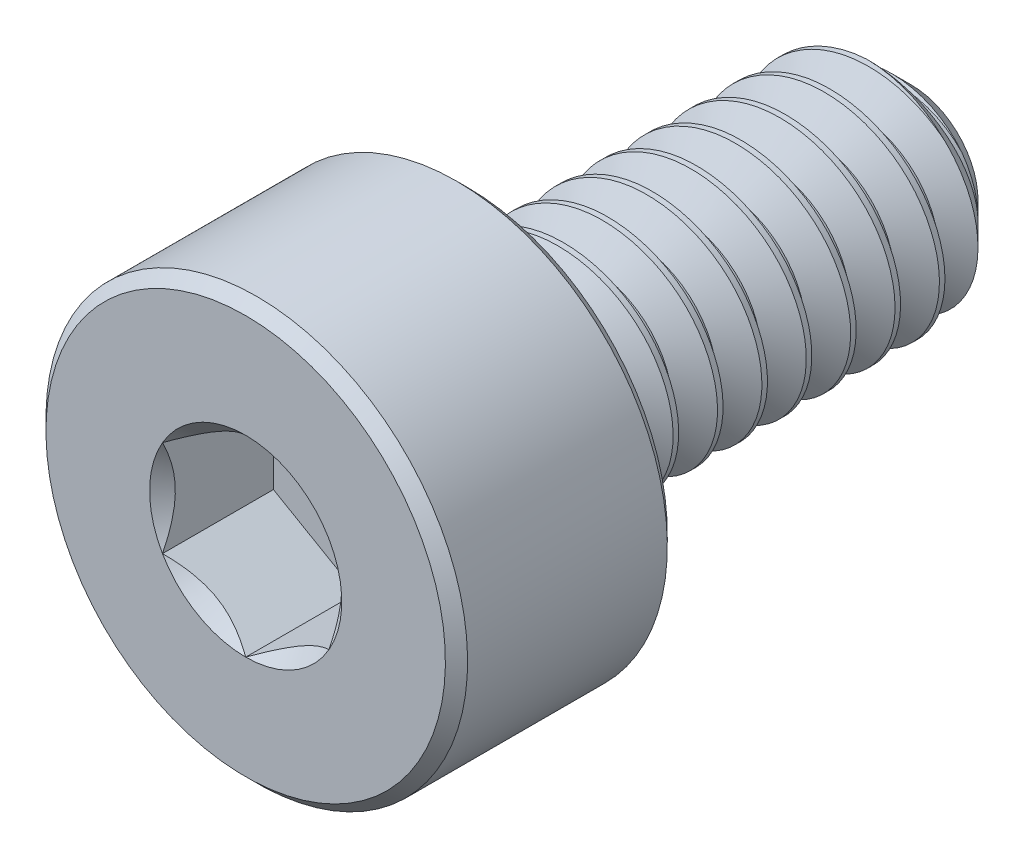
from build123d import *

# Parameters (mm, degrees)
CUT_EXTRUDE1_DEPTH = 1
CUT_SWEEP1_PITCH   = 0.4


# Read off the part's stored shape, not the designer's step: Split1
with BuildPart() as part:
    # Sketch2 → Revolve1 (revolve)
    with BuildSketch(Plane(origin=(0, 0, 0), x_dir=(0, 0, -1), z_dir=(1, 0, 0))):
        Polygon((-3, 0), (-3, 1.8), (-2.9, 1.9), (-1.1, 1.9), (-1, 1.8), (-1, 1), (2.6, 1), (3, 0.6), (3, 0), align=None)
    revolve(axis=Axis((0, 0, -3), (0, 0, 1)))

    # Sketch3 → Cut-Extrude1 (cut)
    with BuildSketch(Plane.XY.offset(3)):
        Polygon((0.75, -0.433012702), (0.75, 0.433012702), (0, 0.866025404), (-0.75, 0.433012702), (-0.75, -0.433012702), (0, -0.866025404), align=None)
    extrude(amount=-CUT_EXTRUDE1_DEPTH, mode=Mode.SUBTRACT)

    # Cut-Extrude2 cone 1 section (through the dimple's axis) → Cut-Extrude2 (revolve, cut)
    with BuildSketch(Plane(origin=(0, 0, 3), x_dir=(0, -1, 0), z_dir=(1, 0, 0))):
        Polygon((0, 0), (0.866025404, 0), (0, 0.866025404), align=None)
    revolve(axis=Axis((0, 0, 3), (0, 0, -1)), mode=Mode.SUBTRACT)


with BuildPart() as body_2:
    # Split1: the piece on the far side of the plane
    add(part.part)
    split(bisect_by=Plane.XY.offset(1), keep=Keep.BOTTOM)

    # Cut-Sweep1: the profile of Sketch7 screwed along a right-hand helix of 11.15 turns, 6 arcs to a turn; built about Z, then put on its axis
    cut_sweep1_z = Axis((0, 0, 0), (0, 0, 1))
    cut_sweep1_corners = [(1.021650635, 0, 0.0125), (1.021650635, 0, -0.3625), (0.740192379, 0, -0.2), (0.740192379, 0, -0.15)]
    with BuildLine(mode=Mode.PRIVATE) as cut_sweep1_profile:
        Line(cut_sweep1_corners[0], cut_sweep1_corners[1])
        Line(cut_sweep1_corners[1], cut_sweep1_corners[2])
        Line(cut_sweep1_corners[2], cut_sweep1_corners[3])
        Line(cut_sweep1_corners[3], cut_sweep1_corners[0])
    cut_sweep1_cap = Face(cut_sweep1_profile.wire())
    cut_sweep1_turn_angles = [0, 30, 60, 90, 120, 150, 180, 210, 240, 270, 300, 330, 360]
    cut_sweep1_turn_weights = [1, 0.8660254037844387, 1, 0.8660254037844387, 1, 0.8660254037844387, 1, 0.8660254037844387, 1, 0.8660254037844387, 1, 0.8660254037844387, 1]
    cut_sweep1_turn_rails = [Edge.make_bspline([Vector(p[0], p[1], 0).rotate(cut_sweep1_z, cut_sweep1_turn_angles[k]) / cut_sweep1_turn_weights[k] + Vector(0, 0, p[2] + CUT_SWEEP1_PITCH * cut_sweep1_turn_angles[k] / 360) for k in range(13)], [0, 0, 0, 1, 1, 2, 2, 3, 3, 4, 4, 5, 5, 6, 6, 6], 2, cut_sweep1_turn_weights) for p in cut_sweep1_corners]
    cut_sweep1_turn_sides = [Face.make_surface_from_curves(cut_sweep1_turn_rails[p[0]], cut_sweep1_turn_rails[p[1]]) for p in [(0, 1), (1, 2), (2, 3), (3, 0)]]
    cut_sweep1_last_angles = [3960, 3987, 4014]
    cut_sweep1_last_weights = [1, 0.8910065241884183, 1]
    cut_sweep1_last_rails = [Edge.make_bspline([Vector(p[0], p[1], 0).rotate(cut_sweep1_z, cut_sweep1_last_angles[k]) / cut_sweep1_last_weights[k] + Vector(0, 0, p[2] + CUT_SWEEP1_PITCH * cut_sweep1_last_angles[k] / 360) for k in range(3)], [0, 0, 0, 1, 1, 1], 2, cut_sweep1_last_weights) for p in cut_sweep1_corners]
    cut_sweep1_last_sides = [Face.make_surface_from_curves(cut_sweep1_last_rails[p[0]], cut_sweep1_last_rails[p[1]]) for p in [(0, 1), (1, 2), (2, 3), (3, 0)]]
    cut_sweep1 = Plane(origin=(0, 0, -3), x_dir=(0, 1, 0), z_dir=(0, 0, 1)) * Solid(Shell([*[p.moved(Location((0, 0, CUT_SWEEP1_PITCH * i))) for i in range(11) for p in cut_sweep1_turn_sides], *cut_sweep1_last_sides, cut_sweep1_cap, cut_sweep1_cap.rotate(cut_sweep1_z, 4014).moved(Location((0, 0, CUT_SWEEP1_PITCH * 4014 / 360)))]))
    add(cut_sweep1, mode=Mode.SUBTRACT)


with BuildPart() as part_1:
    add(part.part)

    # Split1
    split(bisect_by=Plane.XY.offset(1), keep=Keep.TOP)

    add(body_2.part)  # Boss-Extrude1 merges body 2
    # Boss-Extrude1 cone 1 section (through the dimple's axis) → Boss-Extrude1 (revolve)
    with BuildSketch(Plane(origin=(0, 0, 1), x_dir=(0, -1, 0), z_dir=(1, 0, 0))):
        Polygon((0, 0), (1, 0), (0, 1), align=None)
    revolve(axis=Axis((0, 0, 1), (0, 0, -1)))


solid = part_1.part
